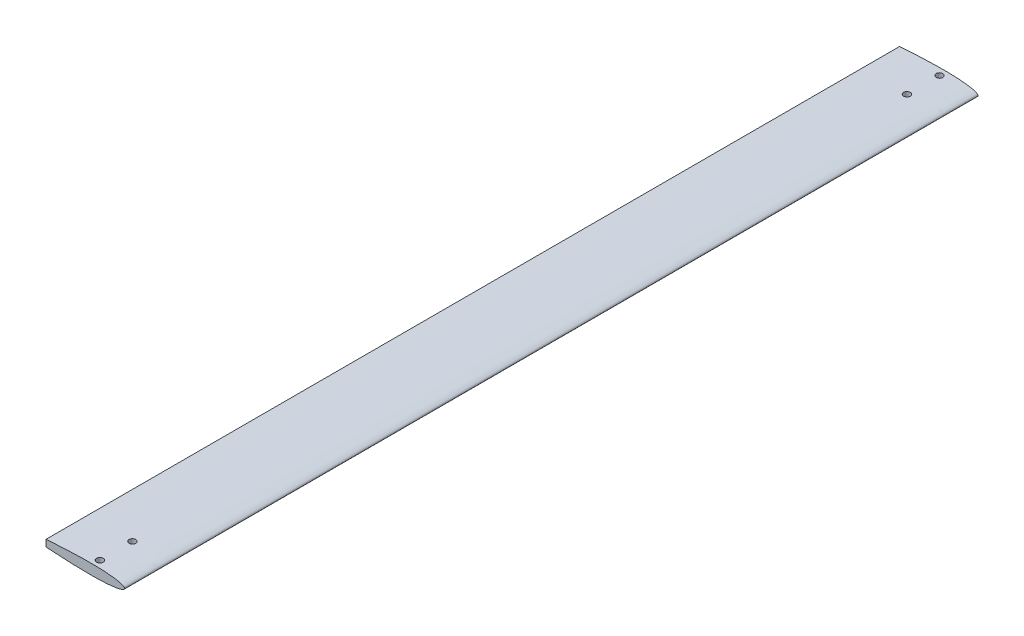
from build123d import *

# Parameters (mm, degrees)
BOSS_EXTRUDE1_DEPTH = 458.7
SKETCH2_R           = 3.6
CUT_EXTRUDE1_DEPTH  = 20


with BuildPart() as part:
    # Sketch1 → Boss-Extrude1 (new, symmetric)
    with BuildSketch(Plane.XY):
        with BuildLine():
            Line((-84.33768, 3.582543782), (-84.33768, -3.582543782))
            add(Edge.make_bspline(
                [(-84.33768, 3.582543782), (-83.283867649, 3.657896364), (-80.141010284, 3.882625573), (-74.860309293, 4.222920713), (-68.472775395, 4.600624946), (-62.014308968, 4.933569718), (-55.555786917, 5.211782269), (-49.167878503, 5.422613119), (-42.92052601, 5.554906131), (-36.882112429, 5.598764138), (-31.118731796, 5.546543722), (-25.693440265, 5.393469745), (-20.665574584, 5.138083037), (-16.089929953, 4.782625882), (-12.016410152, 4.332405909), (-8.488050211, 3.797154612), (-5.543368298, 3.185205232), (-3.203922098, 2.517589629), (-1.494740822, 1.784595978), (-0.356116503, 1.027320596), (0.147228304, 0), (-0.356116503, -1.027320596), (-1.494740822, -1.784595978), (-3.203922098, -2.517589629), (-5.543368298, -3.185205232), (-8.488050211, -3.797154612), (-12.016410152, -4.332405909), (-16.089929953, -4.782625882), (-20.665574584, -5.138083037), (-25.693440265, -5.393469745), (-31.118731796, -5.546543722), (-36.882112429, -5.598764138), (-42.92052601, -5.554906131), (-49.167878503, -5.422613119), (-55.555786917, -5.211782269), (-62.014308968, -4.933569718), (-68.472775395, -4.600624946), (-74.860309293, -4.222920713), (-80.141010284, -3.882625573), (-83.283867649, -3.657896364), (-84.33768, -3.582543782)],
                knots=[0, 0, 0, 0, 0.018499199, 0.055171439, 0.092655195, 0.130538861, 0.168407204, 0.205846372, 0.242448967, 0.277819055, 0.311576982, 0.343363918, 0.372846133, 0.39971914, 0.423712133, 0.444593591, 0.462180115, 0.476353861, 0.487105625, 0.494669113, 0.5, 0.505330887, 0.512894375, 0.523646139, 0.537819885, 0.555406409, 0.576287867, 0.60028086, 0.627153867, 0.656636082, 0.688423018, 0.722180945, 0.757551033, 0.794153628, 0.831592796, 0.869461139, 0.907344805, 0.944828561, 0.981500801, 1, 1, 1, 1], degree=3))
        make_face()
    extrude(amount=BOSS_EXTRUDE1_DEPTH, both=True)

    # Sketch2 → Cut-Extrude1 (cut)
    with BuildSketch(Plane(origin=(0, -10, 0), x_dir=(1, 0, 0), z_dir=(0, 1, 0))):
        with Locations((-33.9, -451.2)):
            Circle(SKETCH2_R)
        with Locations((-33.9, -416.2)):
            Circle(SKETCH2_R)
        with Locations((-33.9, 416.2)):
            Circle(SKETCH2_R)
        with Locations((-33.9, 451.2)):
            Circle(SKETCH2_R)
    extrude(amount=CUT_EXTRUDE1_DEPTH, mode=Mode.SUBTRACT)


solid = part.part
